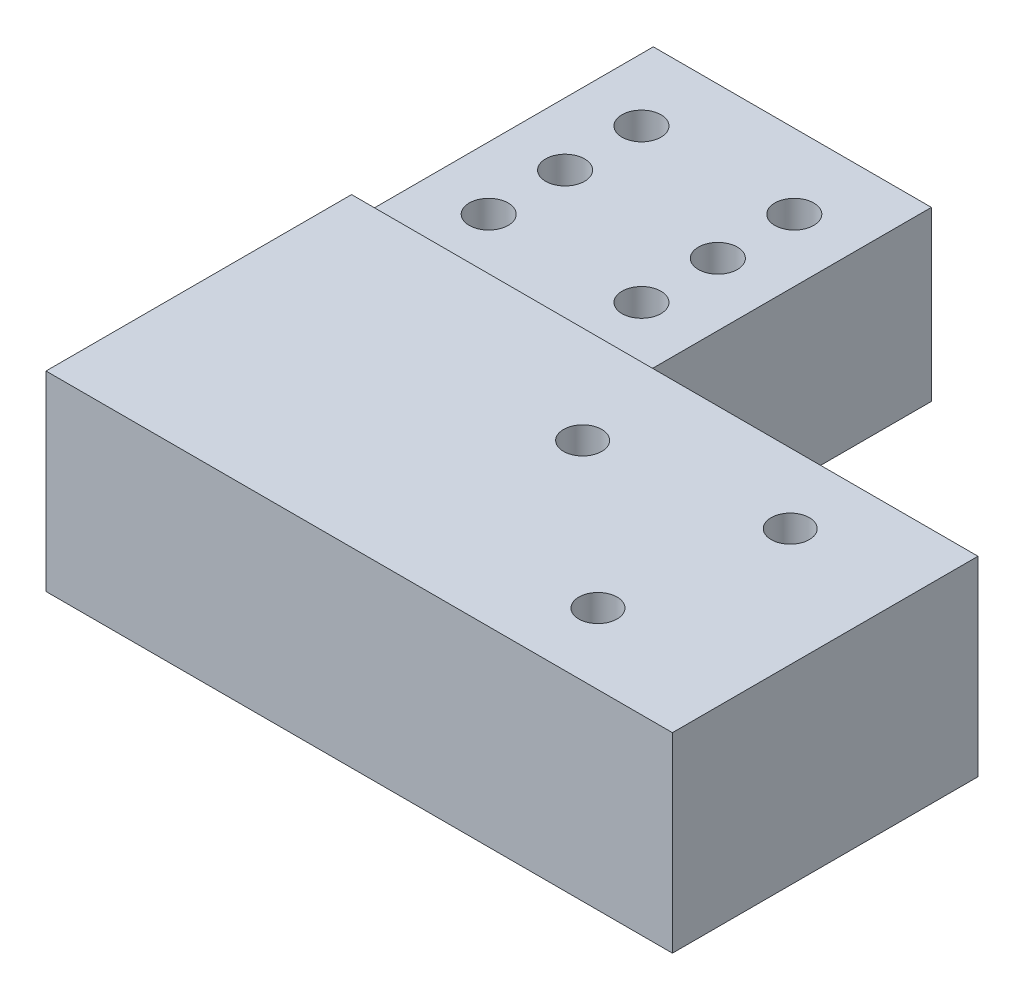
from build123d import *

# Parameters (mm, degrees)
SKETCH1_W               = 36.4
SKETCH1_H               = 39.5
SKETCH1_R               = 2.55
BOSS_EXTRUDE1_DEPTH     = 22
BOSS_EXTRUDE2_START     = -22
SKETCH2_W               = 82
SKETCH2_H               = 40
BOSS_EXTRUDE2_DEPTH     = 25
F_5_0MM_DOWEL_HOLE1_D   = 5
CUT_EXTRUDE1_DEPTH      = 30
CUT_EXTRUDE1_DEPTH_BACK = 50
SKETCH3_W               = 85.710853131
SKETCH3_H               = 93.141989814


with BuildPart() as part:
    # Sketch1 → Boss-Extrude1 (new body)
    with BuildSketch(Plane(origin=(0, 0, 0), x_dir=(1, 0, 0), z_dir=(0, 1, 0))):
        with Locations((18.2, 19.75)):
            Rectangle(SKETCH1_W, SKETCH1_H)
        with Locations((8.2, 29.75)):
            Circle(SKETCH1_R, mode=Mode.SUBTRACT)
        with Locations((28.2, 29.75)):
            Circle(SKETCH1_R, mode=Mode.SUBTRACT)
        with Locations((28.2, 19.75)):
            Circle(SKETCH1_R, mode=Mode.SUBTRACT)
        with Locations((28.2, 9.75)):
            Circle(SKETCH1_R, mode=Mode.SUBTRACT)
        with Locations((8.2, 19.75)):
            Circle(SKETCH1_R, mode=Mode.SUBTRACT)
        with Locations((8.2, 9.75)):
            Circle(SKETCH1_R, mode=Mode.SUBTRACT)
    boss_extrude1 = extrude(amount=BOSS_EXTRUDE1_DEPTH)

    # Sketch2 → Boss-Extrude2 (add)
    with BuildSketch(Plane(origin=(0, 22, 0), x_dir=(1, 0, 0), z_dir=(0, 1, 0)).offset(BOSS_EXTRUDE2_START)):
        with Locations((41, 59.5)):
            Rectangle(SKETCH2_W, SKETCH2_H)
    boss_extrude2 = extrude(amount=BOSS_EXTRUDE2_DEPTH)

    # Mirror3: Boss-Extrude1, Boss-Extrude2 across plane
    add(boss_extrude1.mirror(Plane(origin=(0, 22, 0), x_dir=(1, 0, 0), z_dir=(0, 0, -1))))
    add(boss_extrude2.mirror(Plane(origin=(0, 22, 0), x_dir=(1, 0, 0), z_dir=(0, 0, -1))))

    # Ø5.0mm Dowel Hole1 (through all)
    with Locations(Plane(origin=(42.996100309, 25, 52.24566701), x_dir=(0, 0, 1), z_dir=(0, 1, 0))):
        with Locations((0, 0), (18, 20), (-3.585786438, 23.585786437)):
            Hole(F_5_0MM_DOWEL_HOLE1_D / 2)

    # Sketch3 → Cut-Extrude1 (cut, two sides: drawn at the far end of the back side and taken through both)
    with BuildSketch(Plane(origin=(0, 22, 0), x_dir=(1, 0, 0), z_dir=(0, 1, 0)).offset(-CUT_EXTRUDE1_DEPTH_BACK)):
        with Locations((42.855426566, 46.570994907)):
            Rectangle(SKETCH3_W, SKETCH3_H)
    extrude(amount=CUT_EXTRUDE1_DEPTH + CUT_EXTRUDE1_DEPTH_BACK, mode=Mode.SUBTRACT)


solid = part.part
